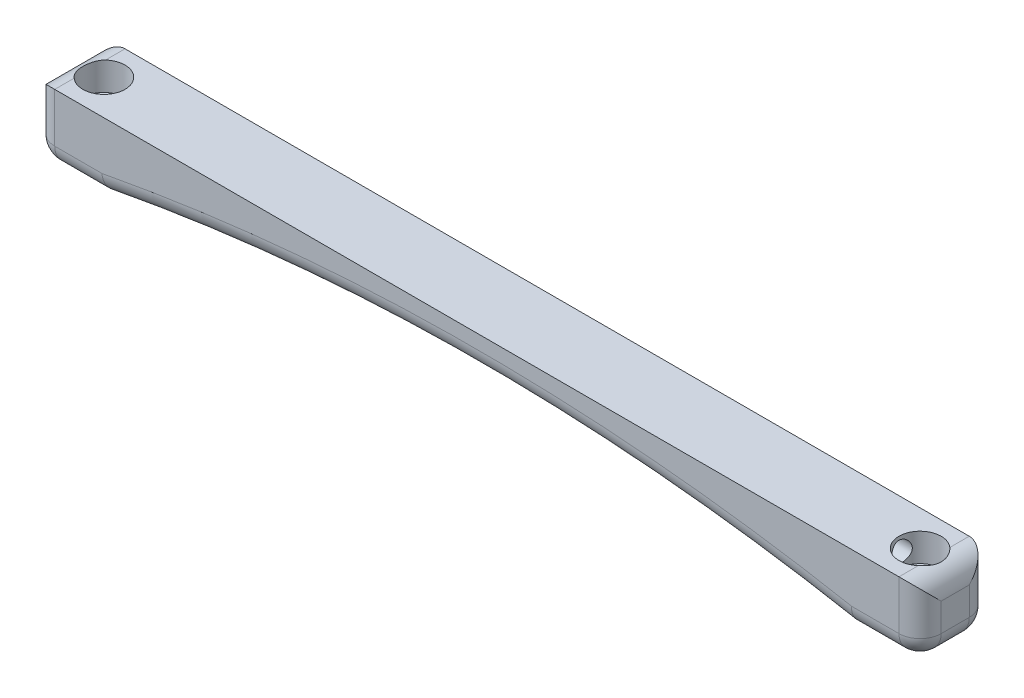
from build123d import *

# Parameters (mm, degrees)
ESBO_O1_W                              = 126.1
ESBO_O1_H                              = 10
RESSALTO_EXTRUS_O1_DEPTH               = 10
CORTE_EXTRUS_O1_DEPTH                  = 65.033604459
CORTE_EXTRUS_O3_DEPTH                  = 3
ESBO_O4_R                              = 3
CORTE_EXTRUS_O4_DEPTH                  = 4
ESBO_O5_R                              = 1.25
CORTE_EXTRUS_O5_DEPTH                  = 65.11943933
CORTE_EXTRUS_O9_REACH                  = 66.034
CORTE_EXTRUS_O9_END_RADIUS             = 3
ESBO_O6_R                              = 1.5
CORTE_EXTRUS_O9_DIRECTION_2_REACH      = 66.034
CORTE_EXTRUS_O9_DIRECTION_2_END_RADIUS = 3
FILETE1_R                              = 3
FILETE2_R                              = 3


with BuildPart() as part:
    # Esboço1 → Ressalto-extrusão1 (new body)
    with BuildSketch(Plane.XY):
        Rectangle(ESBO_O1_W, ESBO_O1_H)
    extrude(amount=RESSALTO_EXTRUS_O1_DEPTH)

    # Esboço2 → Corte-extrusão1 (cut, through all)
    with BuildSketch(Plane.XY.offset(10)):
        with BuildLine():
            Line((-291.82946292, -50.413684991), (-53.05, -5))
            ThreePointArc((-53.05, -5), (0, 0), (53.05, -5))
            Line((53.05, -5), (291.82946292, -50.413684991))
            Line((291.82946292, -50.413684991), (291.82946292, -536.533154655))
            Line((291.82946292, -536.533154655), (-291.82946292, -536.533154655))
            Line((-291.82946292, -536.533154655), (-291.82946292, -50.413684991))
        make_face()
    extrude(amount=-CORTE_EXTRUS_O1_DEPTH, mode=Mode.SUBTRACT)

    # Esboço3 → Corte-extrusão3 (cut)
    with BuildSketch(Plane(origin=(0, -5, 0), x_dir=(1, 0, 0), z_dir=(0, 1, 0))):
        Polygon((-56.354018507, -7.946802806), (-54.650003164, -5.004638346), (-56.345984657, -2.05783554), (-59.745981493, -2.053197194), (-61.449996836, -4.995361654), (-59.754015343, -7.94216446), align=None)
    corte_extrus_o3 = extrude(amount=CORTE_EXTRUS_O3_DEPTH, mode=Mode.SUBTRACT)

    # Esboço4 → Corte-extrusão4 (cut)
    with BuildSketch(Plane(origin=(0, 5, 0), x_dir=(1, 0, 0), z_dir=(0, 1, 0))):
        with Locations(Location((-58.05, -5, 0), (0, 0, 270))):
            Circle(ESBO_O4_R)
    corte_extrus_o4 = extrude(amount=-CORTE_EXTRUS_O4_DEPTH, mode=Mode.SUBTRACT)

    # Esboço5 → Corte-extrusão5 (cut, through all)
    with BuildSketch(Plane(origin=(0, 1, 0), x_dir=(1, 0, 0), z_dir=(0, 1, 0))):
        with Locations(Location((-58.05, -5, 0), (0, 0, 270))):
            Circle(ESBO_O5_R)
    corte_extrus_o5 = extrude(amount=-CORTE_EXTRUS_O5_DEPTH, mode=Mode.SUBTRACT)

    # Espelhar2: Corte-extrusão3, Corte-extrusão4, Corte-extrusão5 across plane
    add(corte_extrus_o3.mirror(Plane(origin=(0, 0, 0), x_dir=(0, 0, 1), z_dir=(1, 0, 0))), mode=Mode.SUBTRACT)
    add(corte_extrus_o4.mirror(Plane(origin=(0, 0, 0), x_dir=(0, 0, 1), z_dir=(1, 0, 0))), mode=Mode.SUBTRACT)
    add(corte_extrus_o5.mirror(Plane(origin=(0, 0, 0), x_dir=(0, 0, 1), z_dir=(1, 0, 0))), mode=Mode.SUBTRACT)

    # Corte-extrusão9: up to this cylinder (the profile starts outside it)
    corte_extrus_o9_end = Plane(origin=(58.05, 3, 5), z_dir=(0, 1, 0)) * Cylinder(CORTE_EXTRUS_O9_END_RADIUS, 139.068, mode=Mode.PRIVATE)
    # Esboço6 → Corte-extrusão9 (cut, up to the surface)
    with BuildSketch(Plane.ZY, mode=Mode.PRIVATE) as corte_extrus_o9_sk1:
        with Locations(Location((5, 3, 0), (0, 0, 180))):
            Circle(ESBO_O6_R)
    corte_extrus_o9_tool1 = extrude(corte_extrus_o9_sk1.sketch, amount=-CORTE_EXTRUS_O9_REACH, mode=Mode.PRIVATE) - corte_extrus_o9_end
    add(corte_extrus_o9_tool1.solids().sort_by_distance((0, 3, 5))[0], mode=Mode.SUBTRACT)

    # Corte-extrusão9 direction 2: up to this cylinder (the profile starts outside it)
    corte_extrus_o9_direction_2_end = Plane(origin=(-58.05, 3, 5), z_dir=(0, 1, 0)) * Cylinder(CORTE_EXTRUS_O9_DIRECTION_2_END_RADIUS, 139.068, mode=Mode.PRIVATE)
    # Esboço6 → Corte-extrusão9 direction 2 (cut, up to the surface)
    with BuildSketch(Plane.ZY, mode=Mode.PRIVATE) as corte_extrus_o9_direction_2_sk1:
        with Locations(Location((5, 3, 0), (0, 0, 180))):
            Circle(ESBO_O6_R)
    corte_extrus_o9_direction_2_tool1 = extrude(corte_extrus_o9_direction_2_sk1.sketch, amount=CORTE_EXTRUS_O9_DIRECTION_2_REACH, mode=Mode.PRIVATE) - corte_extrus_o9_direction_2_end
    add(corte_extrus_o9_direction_2_tool1.solids().sort_by_distance((0, 3, 5))[0], mode=Mode.SUBTRACT)

    # Filete1
    # the kernel refuses this fillet: 3 mm, written as the material it takes off along each edge
    with BuildSketch(Plane(origin=(-63.05, 12.5, 10), x_dir=(1, 0, 0), z_dir=(0, -1, 0)), Plane(origin=(-63.05, 12.5, 0), x_dir=(0, 0, 1), z_dir=(0, -1, 0)), Plane(origin=(63.05, -12.5, 0), x_dir=(0, 0, 1), z_dir=(0, 1, 0)), Plane(origin=(-63.05, 5, -7.5), x_dir=(1, 0, 0), z_dir=(0, 0, 1)), Plane(origin=(63.05, 5, -7.5), x_dir=(0, -1, 0), z_dir=(0, 0, 1))) as filete1_piece_1:
        with BuildLine():
            CenterArc((FILETE1_R, -FILETE1_R), FILETE1_R, 90, 90)
            Line((0, -FILETE1_R), (0, 0))
            Line((0, 0), (FILETE1_R, 0))
        make_face()
    extrude(amount=25, mode=Mode.SUBTRACT)
    with BuildSketch(Plane(origin=(63.05, -12.5, 10), x_dir=(0, 0, -1), z_dir=(0, 1, 0))) as filete1_piece_2:
        with BuildLine():
            CenterArc((FILETE1_R, FILETE1_R), FILETE1_R, 180, 90)
            Line((0, FILETE1_R), (0, 0))
            Line((0, 0), (FILETE1_R, 0))
        make_face()
    extrude(amount=25, mode=Mode.SUBTRACT)

    # Filete2
    # the kernel refuses this fillet: 3 mm, written as the material it takes off along each edge
    with BuildSketch(Plane(origin=(45.55, -5, 0), x_dir=(0, 1, 0), z_dir=(1, 0, 0)), Plane(origin=(-60.05, -5, 10), x_dir=(0, 0, -1), z_dir=(1, 0, 0))) as filete2_piece_1:
        with BuildLine():
            CenterArc((FILETE2_R, FILETE2_R), FILETE2_R, 180, 90)
            Line((0, FILETE2_R), (0, 0))
            Line((0, 0), (FILETE2_R, 0))
        make_face()
    extrude(amount=14.5, mode=Mode.SUBTRACT)
    with BuildSketch(Plane(origin=(45.55, -5, 10), x_dir=(0, 1, 0), z_dir=(1, 0, 0)), Plane(origin=(-60.05, -5, 0), x_dir=(0, 0, 1), z_dir=(1, 0, 0))) as filete2_piece_2:
        with BuildLine():
            CenterArc((FILETE2_R, -FILETE2_R), FILETE2_R, 90, 90)
            Line((0, -FILETE2_R), (0, 0))
            Line((0, 0), (FILETE2_R, 0))
        make_face()
    extrude(amount=14.5, mode=Mode.SUBTRACT)
    with BuildSketch(Plane(origin=(0, -283.93025, 0), x_dir=(0.21272383034714434, 0.9771123640617998, 0), z_dir=(0.9771123640617998, -0.21272383034714434, 0))) as filete2_piece_3:
        with BuildLine():
            CenterArc((283.93025 + FILETE2_R, FILETE2_R), FILETE2_R, 180, 90)
            Line((283.93025, FILETE2_R), (283.93025, 0))
            Line((283.93025, 0), (283.93025 + FILETE2_R, 0))
        make_face()
    revolve(axis=Axis((0, -283.93025, 0), (0, 0, 1)), revolution_arc=24.564047203, mode=Mode.SUBTRACT)
    with BuildSketch(Plane(origin=(0, -283.93025, 10), x_dir=(-0.21272383034714376, 0.9771123640618, 0), z_dir=(-0.9771123640618, -0.21272383034714376, 0))) as filete2_piece_4:
        with BuildLine():
            CenterArc((283.93025 + FILETE2_R, FILETE2_R), FILETE2_R, 180, 90)
            Line((283.93025 + FILETE2_R, 0), (283.93025, 0))
            Line((283.93025, 0), (283.93025, FILETE2_R))
        make_face()
    revolve(axis=Axis((0, -283.93025, 10), (0, 0, -1)), revolution_arc=24.564047203, mode=Mode.SUBTRACT)
    with BuildSketch(Plane(origin=(-60.05, -5, 3), x_dir=(0, 0, -1), z_dir=(1, 0, 0))) as filete2_piece_5:
        with BuildLine():
            CenterArc((3 - FILETE2_R, FILETE2_R), FILETE2_R, 270, 90)
            Line((3, FILETE2_R), (3, 0))
            Line((3, 0), (3 - FILETE2_R, 0))
        make_face()
    revolve(axis=Axis((-60.05, -5, 3), (0, 1, 0)), revolution_arc=90, mode=Mode.SUBTRACT)
    with BuildSketch(Plane(origin=(-63.05, -5, 3), x_dir=(1, 0, 0), z_dir=(0, 0, 1))) as filete2_piece_6:
        with BuildLine():
            CenterArc((FILETE2_R, FILETE2_R), FILETE2_R, 180, 90)
            Line((0, FILETE2_R), (0, 0))
            Line((0, 0), (FILETE2_R, 0))
        make_face()
    extrude(amount=4, mode=Mode.SUBTRACT)
    with BuildSketch(Plane(origin=(-60.05, -5, 7), x_dir=(-1, 0, 0), z_dir=(0, 0, -1))) as filete2_piece_7:
        with BuildLine():
            CenterArc((3 - FILETE2_R, FILETE2_R), FILETE2_R, 270, 90)
            Line((3, FILETE2_R), (3, 0))
            Line((3, 0), (3 - FILETE2_R, 0))
        make_face()
    revolve(axis=Axis((-60.05, -5, 7), (0, 1, 0)), revolution_arc=90, mode=Mode.SUBTRACT)
    with BuildSketch(Plane(origin=(60.05, -5, 7), x_dir=(1, 0, 0), z_dir=(0, 0, -1))) as filete2_piece_8:
        with BuildLine():
            CenterArc((3 - FILETE2_R, -FILETE2_R), FILETE2_R, 0, 90)
            Line((3, -FILETE2_R), (3, 0))
            Line((3, 0), (3 - FILETE2_R, 0))
        make_face()
    revolve(axis=Axis((60.05, -5, 7), (0, -1, 0)), revolution_arc=90, mode=Mode.SUBTRACT)
    with BuildSketch(Plane(origin=(63.05, -5, 3), x_dir=(-1, 0, 0), z_dir=(0, 0, 1))) as filete2_piece_9:
        with BuildLine():
            CenterArc((FILETE2_R, -FILETE2_R), FILETE2_R, 90, 90)
            Line((0, -FILETE2_R), (0, 0))
            Line((0, 0), (FILETE2_R, 0))
        make_face()
    extrude(amount=4, mode=Mode.SUBTRACT)
    with BuildSketch(Plane(origin=(60.05, -5, 3), x_dir=(0, 0, -1), z_dir=(-1, 0, 0))) as filete2_piece_10:
        with BuildLine():
            CenterArc((3 - FILETE2_R, -FILETE2_R), FILETE2_R, 0, 90)
            Line((3 - FILETE2_R, 0), (3, 0))
            Line((3, 0), (3, -FILETE2_R))
        make_face()
    revolve(axis=Axis((60.05, -5, 3), (0, -1, 0)), revolution_arc=90, mode=Mode.SUBTRACT)


solid = part.part
